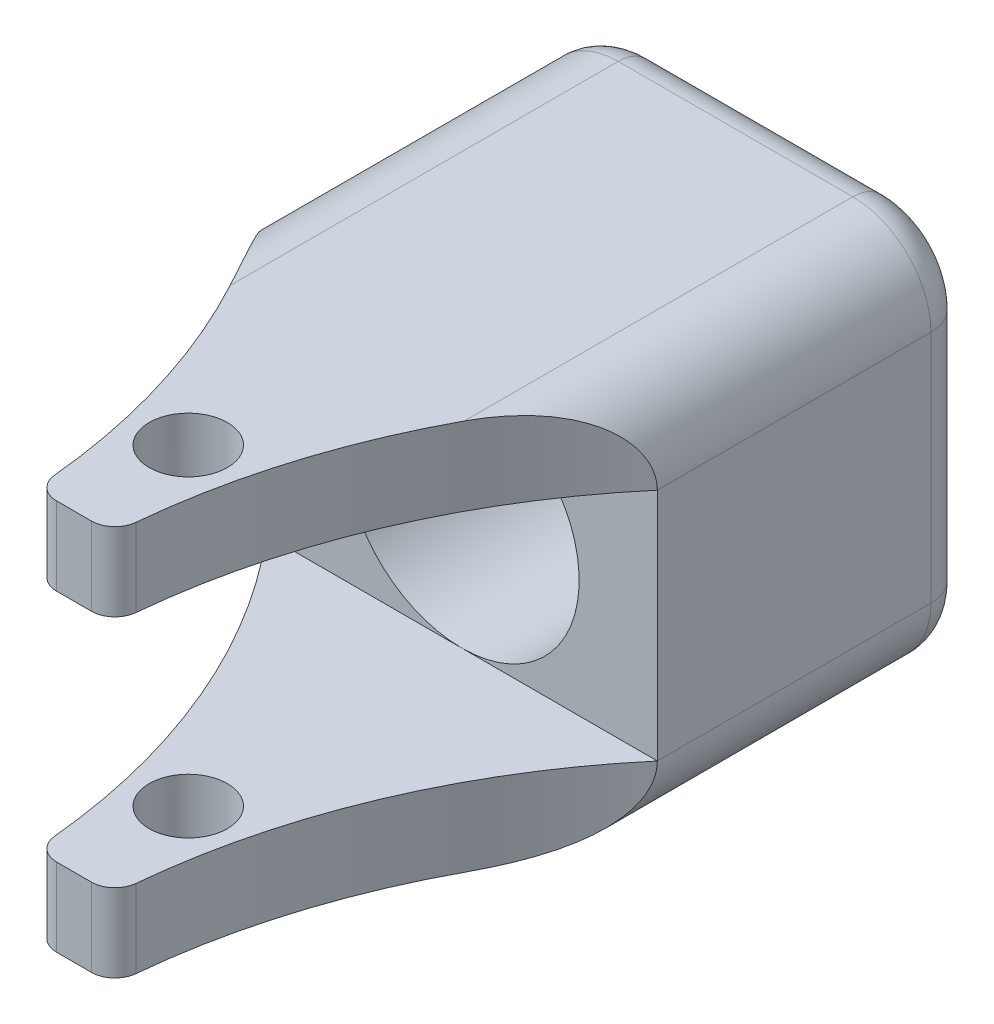
from build123d import *

# Parameters (mm, degrees)
SKETCH1_W           = 50
SKETCH1_H           = 50
BOSS_EXTRUDE1_DEPTH = 89.61
SKETCH2_R           = 15
CUT_EXTRUDE1_DEPTH  = 97.332508013
SKETCH3_W           = 49.61
SKETCH3_H           = 30
CUT_EXTRUDE2_DEPTH  = 106.61700668
FILLET3_R           = 5
FILLET4_R           = 10
SKETCH4_R           = 5
CUT_EXTRUDE3_DEPTH  = 106.61700668


with BuildPart() as part:
    # Sketch1 → Boss-Extrude1 (new body)
    with BuildSketch(Plane.XY):
        Rectangle(SKETCH1_W, SKETCH1_H)
    extrude(amount=BOSS_EXTRUDE1_DEPTH)

    # Sketch2 → Cut-Extrude1 (cut, through all)
    with BuildSketch(Plane(origin=(0, 0, 0), x_dir=(-1, 0, 0), z_dir=(0, 0, -1))):
        Circle(SKETCH2_R)
    extrude(amount=-CUT_EXTRUDE1_DEPTH, mode=Mode.SUBTRACT)

    # Sketch3 → Cut-Extrude2 (cut, through all)
    with BuildSketch(Plane.ZY.offset(25)):
        with Locations((64.805, 0)):
            Rectangle(SKETCH3_W, SKETCH3_H)
    extrude(amount=-CUT_EXTRUDE2_DEPTH, mode=Mode.SUBTRACT)

    # Fillet3
    fillet3_edges = [part.edges().sort_by_distance(p)[0] for p in [
        (0, -25, 0),
        (-25, 0, 0),
        (0, 25, 0),
        (25, 0, 0),
    ]]
    fillet(fillet3_edges, radius=FILLET3_R)

    # Fillet4
    # the kernel refuses this fillet: 10 mm, written as the material it takes off along each edge
    with BuildSketch(Plane(origin=(-15, -15, 0), x_dir=(0, -1, 0), z_dir=(1, 0, 0))) as fillet4_piece_1:
        with BuildLine():
            CenterArc((5, -5), 5, 0, 90)
            Line((10, -5), (10, 0))
            Line((10, 0), (5, 0))
        make_face()
    revolve(axis=Axis((-15, -15, 0), (0, 0, -1)), revolution_arc=90, mode=Mode.SUBTRACT)
    with BuildSketch(Plane(origin=(15, -15, 0), x_dir=(1, 0, 0), z_dir=(0, 1, 0))) as fillet4_piece_2:
        with BuildLine():
            CenterArc((5, -5), 5, 0, 90)
            Line((10, -5), (10, 0))
            Line((10, 0), (5, 0))
        make_face()
    revolve(axis=Axis((15, -15, 0), (0, 0, -1)), revolution_arc=90, mode=Mode.SUBTRACT)
    with BuildSketch(Plane(origin=(15, 15, 0), x_dir=(0, 1, 0), z_dir=(-1, 0, 0))) as fillet4_piece_3:
        with BuildLine():
            CenterArc((5, -5), 5, 0, 90)
            Line((10, -5), (10, 0))
            Line((10, 0), (5, 0))
        make_face()
    revolve(axis=Axis((15, 15, 0), (0, 0, -1)), revolution_arc=90, mode=Mode.SUBTRACT)
    with BuildSketch(Plane(origin=(-15, 15, 0), x_dir=(-1, 0, 0), z_dir=(0, -1, 0))) as fillet4_piece_4:
        with BuildLine():
            CenterArc((5, -5), 5, 0, 90)
            Line((10, -5), (10, 0))
            Line((10, 0), (5, 0))
        make_face()
    revolve(axis=Axis((-15, 15, 0), (0, 0, -1)), revolution_arc=90, mode=Mode.SUBTRACT)
    with BuildSketch(Plane(origin=(-25, 25, 0), x_dir=(1, 0, 0), z_dir=(0, 0, 1)), Plane(origin=(-25, -25, 0), x_dir=(0, 1, 0), z_dir=(0, 0, 1))) as fillet4_piece_5:
        with BuildLine():
            CenterArc((FILLET4_R, -FILLET4_R), FILLET4_R, 90, 90)
            Line((0, -FILLET4_R), (0, 0))
            Line((0, 0), (FILLET4_R, 0))
        make_face()
    extrude(amount=114.61, mode=Mode.SUBTRACT)
    with BuildSketch(Plane(origin=(25, 25, 0), x_dir=(-1, 0, 0), z_dir=(0, 0, 1)), Plane(origin=(25, -25, 0), x_dir=(0, 1, 0), z_dir=(0, 0, 1))) as fillet4_piece_6:
        with BuildLine():
            CenterArc((FILLET4_R, FILLET4_R), FILLET4_R, 180, 90)
            Line((0, FILLET4_R), (0, 0))
            Line((0, 0), (FILLET4_R, 0))
        make_face()
    extrude(amount=114.61, mode=Mode.SUBTRACT)

    # Sketch4 → Cut-Extrude3 (cut, through all)
    with BuildSketch(Plane(origin=(0, 25, 0), x_dir=(1, 0, 0), z_dir=(0, 1, 0))):
        with Locations(Location((0, -75, 0), (0, 0, 270))):
            Circle(SKETCH4_R)
        with BuildLine():
            Line((-2.228917094, -89.61), (2.228917094, -89.61))
            ThreePointArc((2.228917094, -89.61), (4.246928068, -88.829826954), (5.21534053, -86.895087804))
            ThreePointArc((5.21534053, -86.895087804), (11.515192631, -61.931906551), (25, -40))
            add(Edge.make_bspline(
                [(-25, -40), (-88.150639052, -71.432998628), (-33.241224171, -142.040624048), (62.119232947, -121.01307169), (53.993290676, -50.260593277), (25, -40)],
                knots=[0, 0, 0, 0, 0.488610216, 0.657386139, 1, 1, 1, 1], degree=3))
            ThreePointArc((-25, -40), (-11.515192631, -61.931906551), (-5.21534053, -86.895087804))
            ThreePointArc((-5.21534053, -86.895087804), (-4.246928068, -88.829826954), (-2.228917094, -89.61))
        make_face()
    extrude(amount=-CUT_EXTRUDE3_DEPTH, mode=Mode.SUBTRACT)


solid = part.part
